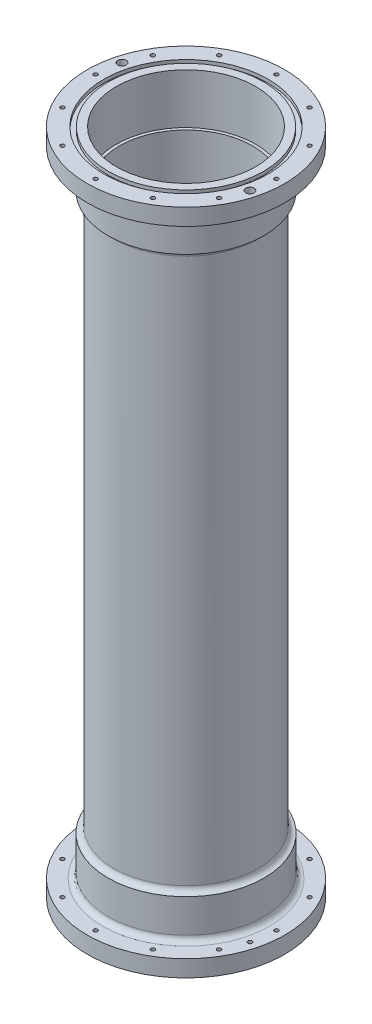
from build123d import *

# Parameters (mm, degrees)
SKETCH2_R               = 41.275
SKETCH2_R_2             = 38.1
BASE_CYLINDER_DEPTH     = 381
SKETCH3_R               = 56.35625
SKETCH3_R_2             = 38.1
AFT_FLANGE_DEPTH        = 9.525
SKETCH34_R              = 39.75
TEMPERATUREINSERT_DEPTH = 28.575
SKETCH6_R               = 46.9011
SKETCH6_R_2             = 44.2849
AFT_O_RING_DEPTH        = 1.9812
SKETCH33_R              = 44.45
SKETCH33_R_2            = 41.275
CRITICALBOSS_DEPTH      = 22.225
FILLET1_R               = 3.175
BOLT_CIRCLE_D           = 2.2606
BOLT_CIRCLE_DEPTH       = 381
HOLE1_D                 = 2.38125
HOLE1_DEPTH             = 381
HOLE1_CBORE_D           = 4.7625
HOLE1_CBORE_DEPTH       = 4.7625
FILLET1_OF_MIRROR1_R    = 3.175


with BuildPart() as part:
    # Sketch2 → Base Cylinder (new body)
    with BuildSketch(Plane(origin=(0, 0, 0), x_dir=(1, 0, 0), z_dir=(0, 1, 0))):
        with Locations(Location((0, 0, 0), (0, 0, 270))):
            Circle(SKETCH2_R)
        with Locations(Location((0, 0, 0), (0, 0, 270))):
            Circle(SKETCH2_R_2, mode=Mode.SUBTRACT)
    extrude(amount=BASE_CYLINDER_DEPTH)

    # Sketch3 → Aft Flange (add)
    with BuildSketch(Plane.XZ):
        with Locations(Location((0, 0, 0), (0, 0, 270))):
            Circle(SKETCH3_R)
        with Locations(Location((0, 0, 0), (0, 0, 90))):
            Circle(SKETCH3_R_2, mode=Mode.SUBTRACT)
    aft_flange = extrude(amount=-AFT_FLANGE_DEPTH)

    # Sketch34 → TemperatureInsert (cut)
    with BuildSketch(Plane.XZ):
        with Locations(Location((0, 0, 0), (0, 0, 270))):
            Circle(SKETCH34_R)
    temperatureinsert = extrude(amount=-TEMPERATUREINSERT_DEPTH, mode=Mode.SUBTRACT)

    # Sketch6 → Aft O-Ring (cut)
    with BuildSketch(Plane.XZ):
        with Locations(Location((0, 0, 0), (0, 0, 270))):
            Circle(SKETCH6_R)
        with Locations(Location((0, 0, 0), (0, 0, 270))):
            Circle(SKETCH6_R_2, mode=Mode.SUBTRACT)
    aft_o_ring = extrude(amount=-AFT_O_RING_DEPTH, mode=Mode.SUBTRACT)

    # Sketch33 → CriticalBoss (add)
    with BuildSketch(Plane(origin=(0, 9.525, 0), x_dir=(1, 0, 0), z_dir=(0, 1, 0))):
        with Locations(Location((0, 0, 0), (0, 0, 90))):
            Circle(SKETCH33_R)
        with Locations(Location((0, 0, 0), (0, 0, 270))):
            Circle(SKETCH33_R_2, mode=Mode.SUBTRACT)
    criticalboss = extrude(amount=CRITICALBOSS_DEPTH)

    # Fillet1
    fillet1_edges = [part.edges().sort_by_distance(p)[0] for p in [
        (0, 9.525, 44.45),
        (0, 31.75, -41.275),
    ]]
    fillet(fillet1_edges, radius=FILLET1_R - 0.0001)  # a hair under: the kernel refuses the full size

    # Bolt Circle
    with Locations(Plane(origin=(0, 0, 0), x_dir=(-1, 0, 0), z_dir=(0, -1, 0))):
        with Locations((-25.81275, -44.708994483), (-44.708994483, -25.81275), (-51.6255, 0), (-44.708994483, 25.81275), (-25.81275, 44.708994483), (0, 51.6255), (25.81275, 44.708994483), (44.708994483, 25.81275), (51.6255, 0), (44.708994483, -25.81275), (25.81275, -44.708994483), (0, -51.6255)):
            bolt_circle = Hole(BOLT_CIRCLE_D / 2, depth=BOLT_CIRCLE_DEPTH)

    # Hole1
    with Locations(Plane(origin=(0, 0, 0), x_dir=(-1, 0, 0), z_dir=(0, -1, 0))):
        with Locations((49.866403745, 13.361662613), (-49.866403745, -13.361662613)):
            hole1 = CounterBoreHole(HOLE1_D / 2, HOLE1_CBORE_D / 2, HOLE1_CBORE_DEPTH, depth=HOLE1_DEPTH)

    # Mirror1: Aft Flange, TemperatureInsert, Aft O-Ring, CriticalBoss, Bolt Circle, Hole1 across plane
    add(aft_flange.mirror(Plane.ZX.offset(190.5)))
    add(temperatureinsert.mirror(Plane.ZX.offset(190.5)), mode=Mode.SUBTRACT)
    add(aft_o_ring.mirror(Plane.ZX.offset(190.5)), mode=Mode.SUBTRACT)
    add(criticalboss.mirror(Plane.ZX.offset(190.5)))
    add(bolt_circle.mirror(Plane.ZX.offset(190.5)), mode=Mode.SUBTRACT)
    add(hole1.mirror(Plane.ZX.offset(190.5)), mode=Mode.SUBTRACT)

    # Fillet1 of Mirror1
    fillet1_of_mirror1_edges = [part.edges().sort_by_distance(p)[0] for p in [
        (0, 371.475, 44.45),
        (0, 349.25, -41.275),
    ]]
    fillet(fillet1_of_mirror1_edges, radius=FILLET1_OF_MIRROR1_R - 0.0001)  # a hair under: the kernel refuses the full size


solid = part.part
